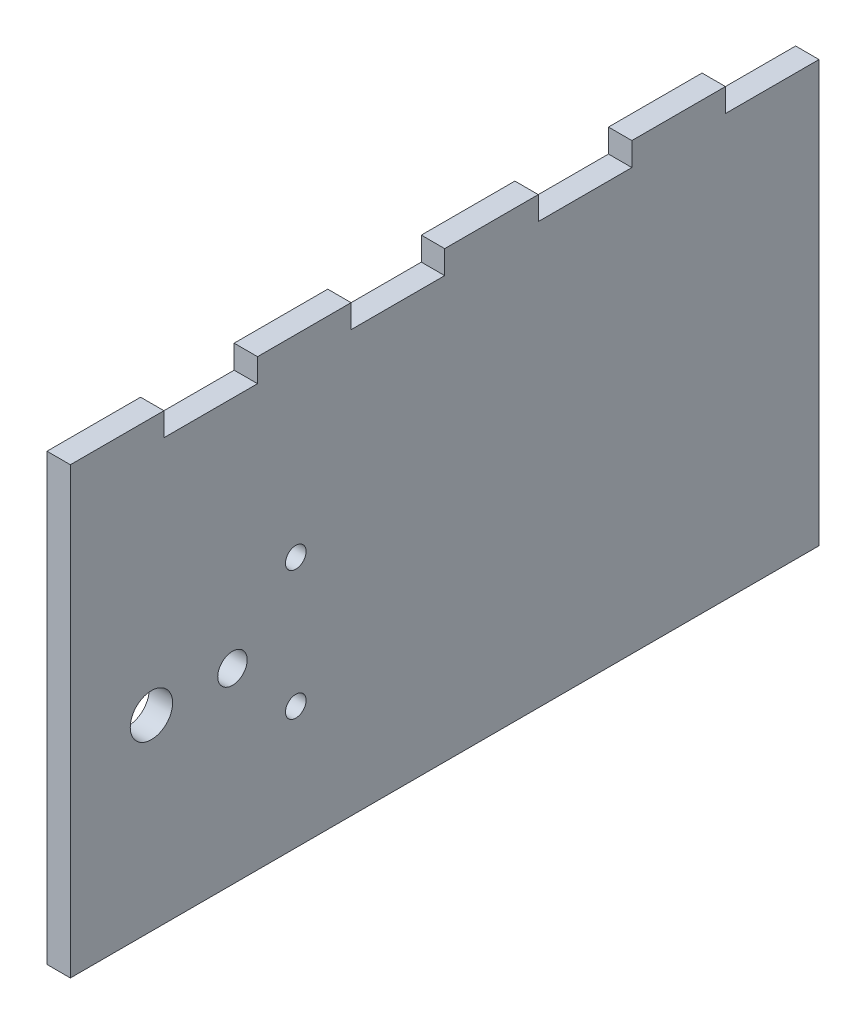
from build123d import *

# Parameters (mm, degrees)
BOSS_EXTRUDE1_DEPTH = 3.175
CUT_EXTRUDE1_REACH  = 120.202
SKETCH2_R           = 1.4
SKETCH2_R_2         = 2
SKETCH2_R_3         = 2.876999961


with BuildPart() as part:
    # Sketch1 → Boss-Extrude1 (new body)
    with BuildSketch(Plane(origin=(0, 0, 0), x_dir=(0, 0, -1), z_dir=(1, 0, 0))):
        Polygon((0, 0), (0, 60.325), (12.7, 60.325), (12.7, 57.15), (25.4, 57.15), (25.4, 60.325), (38.1, 60.325), (38.1, 57.15), (50.8, 57.15), (50.8, 60.325), (63.5, 60.325), (63.5, 57.15), (76.2, 57.15), (76.2, 60.325), (88.9, 60.325), (88.9, 57.15), (101.6, 57.15), (101.6, 0), align=None)
    extrude(amount=BOSS_EXTRUDE1_DEPTH)

    # Sketch2 → Cut-Extrude1 (cut, up to next)
    with BuildSketch(Plane(origin=(3.175, 0, 0), x_dir=(0, 0, -1), z_dir=(1, 0, 0)), mode=Mode.PRIVATE) as cut_extrude1_sk1:
        with Locations((30.59102, 16.65)):
            Circle(SKETCH2_R)
    cut_extrude1_tool1 = extrude(cut_extrude1_sk1.sketch, amount=-CUT_EXTRUDE1_REACH, mode=Mode.PRIVATE) & part.part
    # Sketch2 → Cut-Extrude1 (cut, up to next)
    with BuildSketch(Plane(origin=(3.175, 0, 0), x_dir=(0, 0, -1), z_dir=(1, 0, 0)), mode=Mode.PRIVATE) as cut_extrude1_sk2:
        with Locations((30.59102, 34.15)):
            Circle(SKETCH2_R)
    cut_extrude1_tool2 = extrude(cut_extrude1_sk2.sketch, amount=-CUT_EXTRUDE1_REACH, mode=Mode.PRIVATE) & part.part
    # Sketch2 → Cut-Extrude1 (cut, up to next)
    with BuildSketch(Plane(origin=(3.175, 0, 0), x_dir=(0, 0, -1), z_dir=(1, 0, 0)), mode=Mode.PRIVATE) as cut_extrude1_sk3:
        with Locations((22.0000034, 25.4)):
            Circle(SKETCH2_R_2)
    cut_extrude1_tool3 = extrude(cut_extrude1_sk3.sketch, amount=-CUT_EXTRUDE1_REACH, mode=Mode.PRIVATE) & part.part
    # Sketch2 → Cut-Extrude1 (cut, up to next)
    with BuildSketch(Plane(origin=(3.175, 0, 0), x_dir=(0, 0, -1), z_dir=(1, 0, 0)), mode=Mode.PRIVATE) as cut_extrude1_sk4:
        with Locations((11, 25.4)):
            Circle(SKETCH2_R_3)
    cut_extrude1_tool4 = extrude(cut_extrude1_sk4.sketch, amount=-CUT_EXTRUDE1_REACH, mode=Mode.PRIVATE) & part.part
    add(cut_extrude1_tool1.solids().sort_by_distance((3.175, 16.65, -30.59102))[0], mode=Mode.SUBTRACT)
    add(cut_extrude1_tool2.solids().sort_by_distance((3.175, 34.15, -30.59102))[0], mode=Mode.SUBTRACT)
    add(cut_extrude1_tool3.solids().sort_by_distance((3.175, 25.4, -22.000003))[0], mode=Mode.SUBTRACT)
    add(cut_extrude1_tool4.solids().sort_by_distance((3.175, 25.4, -11))[0], mode=Mode.SUBTRACT)


solid = part.part
